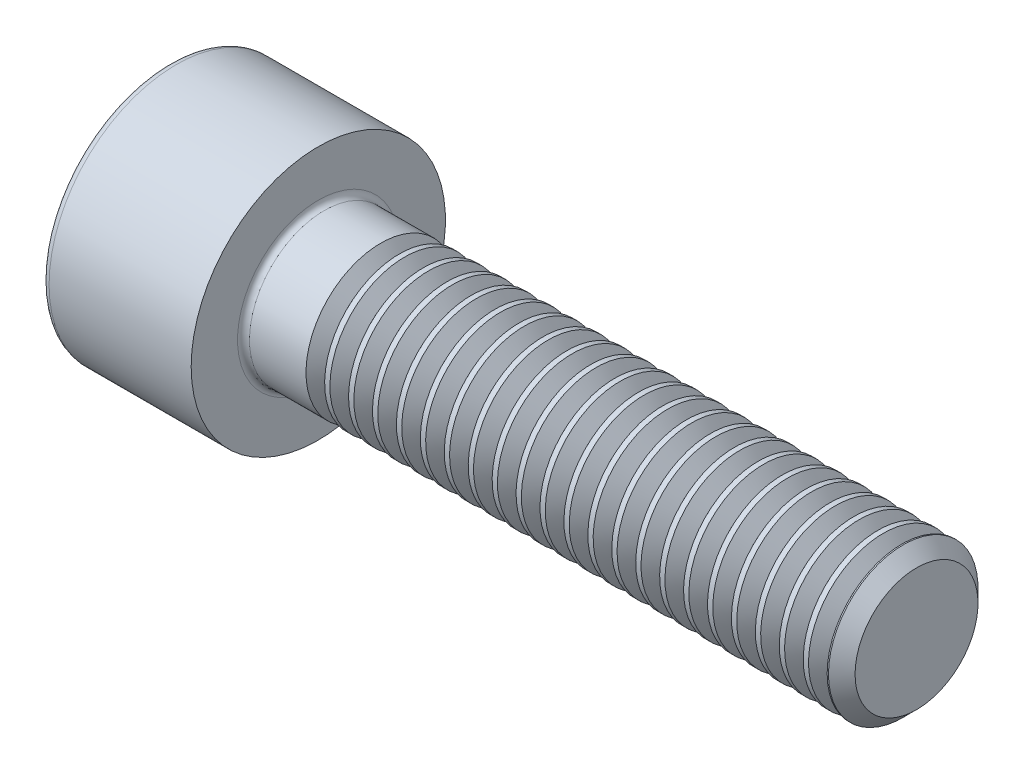
from build123d import *

# Parameters (mm, degrees)
FILLET1_R       = 0.2
FILLET2_R       = 0.25
HEX_2_DEPTH     = 2.5
THDSCHPAT_COUNT = 23
THDSCHPAT_PITCH = 0.8


with BuildPart() as part:
    # BodySke → Base-Revolve (revolve)
    with BuildSketch(Plane.XY):
        Polygon((0, 0), (0, 4.25), (5, 4.25), (5, 2.5), (24.555, 2.5), (25, 2.055), (25, 0), align=None)
    revolve(axis=Axis((-31.75, 0, 0), (1, 0, 0)))

    # Fillet1
    fillet1_edges = [part.edges().sort_by_distance(p)[0] for p in [
        (5, -2.5, 0),
    ]]
    fillet(fillet1_edges, radius=FILLET1_R)

    # Fillet2
    fillet2_edges = [part.edges().sort_by_distance(p)[0] for p in [
        (0, -4.25, 0),
    ]]
    fillet(fillet2_edges, radius=FILLET2_R)

    # Sketch2 → Hex-PreBroach (revolve, cut)
    with BuildSketch(Plane.XY):
        Polygon((0, 2.042), (2.5, 2.042), (3.67894925, 0), (0, 0), align=None)
    revolve(axis=Axis((0, 0, 0), (1, 0, 0)), mode=Mode.SUBTRACT)

    # Sketch3 → Hex 2 (cut)
    with BuildSketch(Plane(origin=(0, 0, 0), x_dir=(0, 0.500000000000001, 0.866025403784438), z_dir=(-1, 0, 0))):
        Polygon((1.17894925, 2.042), (-1.17894925, 2.042), (-2.357898499, 0), (-1.17894925, -2.042), (1.17894925, -2.042), (2.357898499, 0), align=None)
    extrude(amount=-HEX_2_DEPTH, mode=Mode.SUBTRACT)

    # ThdSchSke → ThreadSchematic (revolve, cut)
    with BuildSketch(Plane.XY):
        Polygon((7.4, -2.055), (7.088407645, -2.5), (7.088407645, -3.125), (7.711592355, -3.125), (7.711592355, -2.5), align=None)
    threadschematic = revolve(axis=Axis((-3.175, 0, 0), (1, 0, 0)), mode=Mode.SUBTRACT)

    # ThdSchPat: ThreadSchematic ×23
    with Locations(*[(i * THDSCHPAT_PITCH, 0, 0) for i in range(1, THDSCHPAT_COUNT)]):
        add(threadschematic, mode=Mode.SUBTRACT)


solid = part.part
